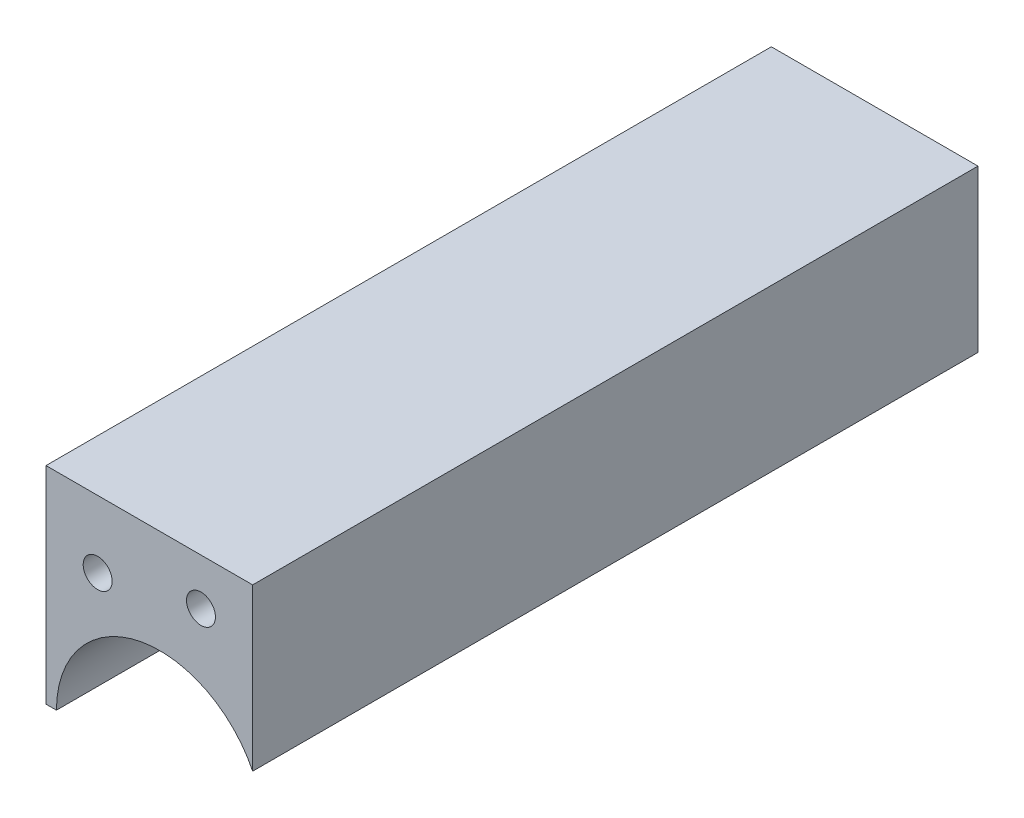
from build123d import *

# Parameters (mm, degrees)
SKETCH1_R           = 1.4
BOSS_EXTRUDE1_DEPTH = 70.2


with BuildPart() as part:
    # Sketch1 → Boss-Extrude1 (new body)
    with BuildSketch(Plane.XY):
        with BuildLine():
            Line((0, 0), (1.01, 0))
            ThreePointArc((1.01, 0), (8.762779495, 9.744229061), (20, 4.379486271))
            Line((20, 4.379486271), (20, 20))
            Line((20, 20), (0, 20))
            Line((0, 20), (0, 0))
        make_face()
        with Locations((5, 13.5)):
            Circle(SKETCH1_R, mode=Mode.SUBTRACT)
        with Locations((15, 15.5)):
            Circle(SKETCH1_R, mode=Mode.SUBTRACT)
    extrude(amount=BOSS_EXTRUDE1_DEPTH)


solid = part.part
